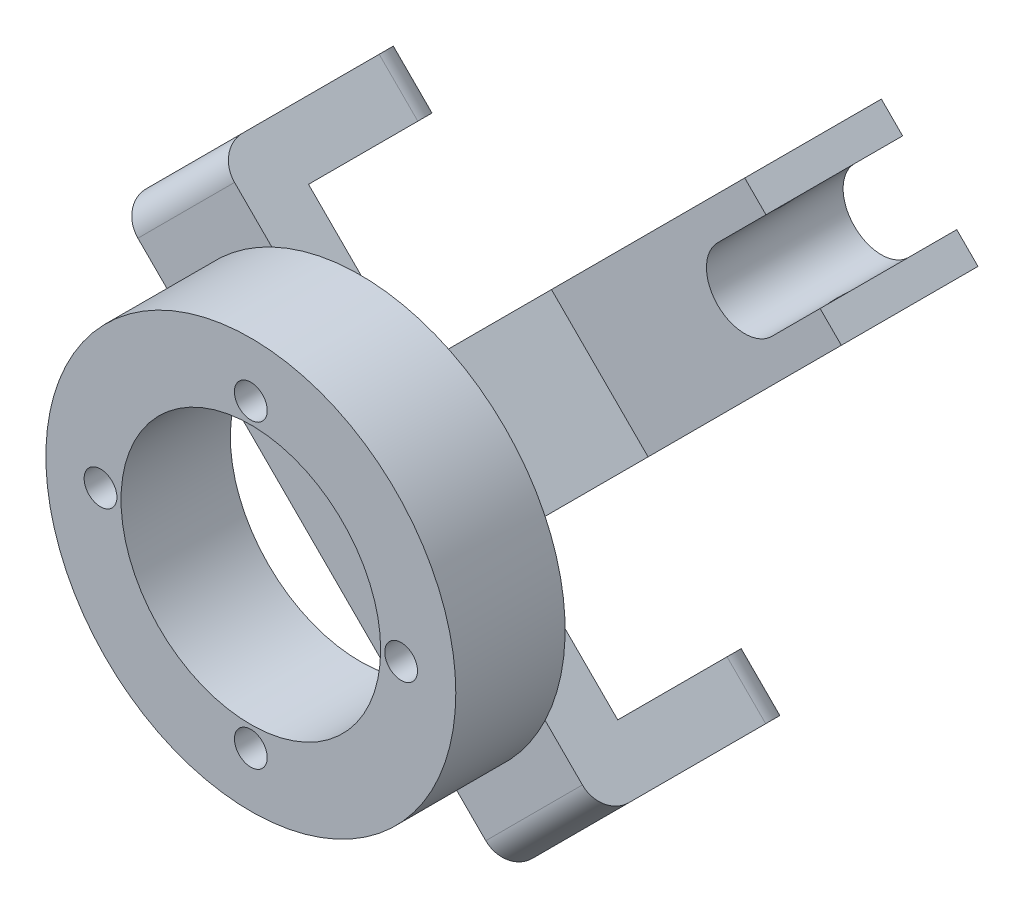
from build123d import *

# Parameters (mm, degrees)
SZKIC1_R                    = 75
DODANIE_WYCI_GNI_CIE1_DEPTH = 40
SZKIC2_R                    = 6
WYTNIJ_WYCI_GNI_CIE1_DEPTH  = 40
SZKIC3_R                    = 47.5
WYTNIJ_WYCI_GNI_CIE2_DEPTH  = 40
SZKIC4_W                    = 50
SZKIC4_H                    = 20
DODANIE_WYCI_GNI_CIE2_DEPTH = 100
SZKIC6_W                    = 50
SZKIC6_H                    = 49.999779654
DODANIE_WYCI_GNI_CIE3_DEPTH = 20
SZKIC7_R                    = 7
WYTNIJ_WYCI_GNI_CIE3_DEPTH  = 236.637433359
ZAOKR_GLENIE1_R             = 10
ZAOKR_GLENIE2_R             = 10
DODANIE_WYCI_GNI_CIE4_DEPTH = 100
SZKIC10_W                   = 50
SZKIC10_H                   = 50
DODANIE_WYCI_GNI_CIE5_DEPTH = 100
SZKIC12_R                   = 7
WYTNIJ_WYCI_GNI_CIE5_DEPTH  = 203.39194648
WYTNIJ_WYCI_GNI_CIE6_DEPTH  = 220.317121995


with BuildPart() as part:
    # Szkic1 → Dodanie-wyciągnięcie1 (new body)
    with BuildSketch(Plane.XY):
        Circle(SZKIC1_R)
    extrude(amount=DODANIE_WYCI_GNI_CIE1_DEPTH)

    # Szkic2 → Wytnij-wyciągnięcie1 (cut)
    with BuildSketch(Plane.XY.offset(40)):
        with Locations((-55, 0)):
            Circle(SZKIC2_R)
        with Locations((0, 55)):
            Circle(SZKIC2_R)
        with Locations((55, 0)):
            Circle(SZKIC2_R)
        with Locations((0, -55)):
            Circle(SZKIC2_R)
    extrude(amount=-WYTNIJ_WYCI_GNI_CIE1_DEPTH, mode=Mode.SUBTRACT)

    # Szkic3 → Wytnij-wyciągnięcie2 (cut)
    with BuildSketch(Plane.XY.offset(40)):
        Circle(SZKIC3_R)
    extrude(amount=-WYTNIJ_WYCI_GNI_CIE2_DEPTH, mode=Mode.SUBTRACT)

    # Szkic4 → Dodanie-wyciągnięcie2 (add, symmetric)
    with BuildSketch(Plane(origin=(0, 0, 0), x_dir=(-0.7071067811865477, -0.7071067811865475, 0), z_dir=(0.7071067811865475, -0.7071067811865477, 0))):
        with Locations((0, 10)):
            Rectangle(SZKIC4_W, SZKIC4_H)
    extrude(amount=DODANIE_WYCI_GNI_CIE2_DEPTH, both=True)

    # Szkic6 → Dodanie-wyciągnięcie3 (add)
    with BuildSketch(Plane(origin=(70.710678119, -70.710678119, 0), x_dir=(0, 0, -1), z_dir=(0.7071067811865474, -0.7071067811865477, 0))):
        with Locations((45, 0.000110173)):
            Rectangle(SZKIC6_W, SZKIC6_H)
    dodanie_wyci_gni_cie3 = extrude(amount=-DODANIE_WYCI_GNI_CIE3_DEPTH)

    # Lustro1: Dodanie-wyciągnięcie3 across plane
    add(dodanie_wyci_gni_cie3.mirror(Plane(origin=(0, 0, 0), x_dir=(0, 0, 1), z_dir=(0.7071067811865475, -0.7071067811865477, 0))))

    # Szkic7 → Wytnij-wyciągnięcie3 (cut, through all)
    with BuildSketch(Plane(origin=(-70.710678119, 70.710678119, 0), x_dir=(0, 0, 1), z_dir=(-0.7071067811865474, 0.7071067811865477, 0))):
        with Locations((-45, 0)):
            Circle(SZKIC7_R)
    extrude(amount=-WYTNIJ_WYCI_GNI_CIE3_DEPTH, mode=Mode.SUBTRACT)

    # Zaokrąglenie1
    zaokr_glenie1_edges = [part.edges().sort_by_distance(p)[0] for p in [
        (45.962096585, -81.317124028, -70),
        (81.317279836, -45.961940777, -70),
        (-45.961940777, 81.317279836, -70),
        (-81.317124028, 45.962096585, -70),
    ]]
    fillet(zaokr_glenie1_edges, radius=ZAOKR_GLENIE1_R)

    # Zaokrąglenie2
    zaokr_glenie2_edges = [part.edges().sort_by_distance(p)[0] for p in [
        (70.710678119, -70.710678119, 0),
        (-70.710678119, 70.710678119, 0),
    ]]
    fillet(zaokr_glenie2_edges, radius=ZAOKR_GLENIE2_R)

    # Szkic8 → Dodanie-wyciągnięcie4 (add)
    with BuildSketch(Plane(origin=(0, 0, -20), x_dir=(-1, 0, 0), z_dir=(0, 0, -1))):
        Polygon((0, 35.355339059), (35.355339059, 0), (0, -35.355339059), (-35.355339059, 0), align=None)
    extrude(amount=DODANIE_WYCI_GNI_CIE4_DEPTH)

    # Szkic10 → Dodanie-wyciągnięcie5 (add)
    with BuildSketch(Plane(origin=(17.67766953, 17.67766953, 0), x_dir=(0, 0, -1), z_dir=(0.7071067811865476, 0.7071067811865476, 0))):
        with Locations((95, 0)):
            Rectangle(SZKIC10_W, SZKIC10_H)
    extrude(amount=DODANIE_WYCI_GNI_CIE5_DEPTH)

    # Szkic12 → Wytnij-wyciągnięcie5 (cut, through all)
    with BuildSketch(Plane(origin=(17.67766953, -17.67766953, 0), x_dir=(0, 0, -1), z_dir=(0.7071067811865475, -0.7071067811865477, 0))):
        with Locations((95, 105)):
            Circle(SZKIC12_R)
    extrude(amount=-WYTNIJ_WYCI_GNI_CIE5_DEPTH, mode=Mode.SUBTRACT)

    # Szkic14 → Wytnij-wyciągnięcie6 (cut, through all)
    with BuildSketch(Plane(origin=(0, 0, -120), x_dir=(-1, 0, 0), z_dir=(0, 0, -1))):
        with BuildLine():
            Line((-80.610173055, 60.811183182), (-98.287842585, 78.488852712))
            Line((-98.287842585, 78.488852712), (-78.488852712, 98.287842585))
            Line((-78.488852712, 98.287842585), (-60.811183182, 80.610173055))
            ThreePointArc((-60.811183182, 80.610173055), (-60.811183182, 60.811183182), (-80.610173055, 60.811183182))
        make_face()
    extrude(amount=-WYTNIJ_WYCI_GNI_CIE6_DEPTH, mode=Mode.SUBTRACT)


solid = part.part
